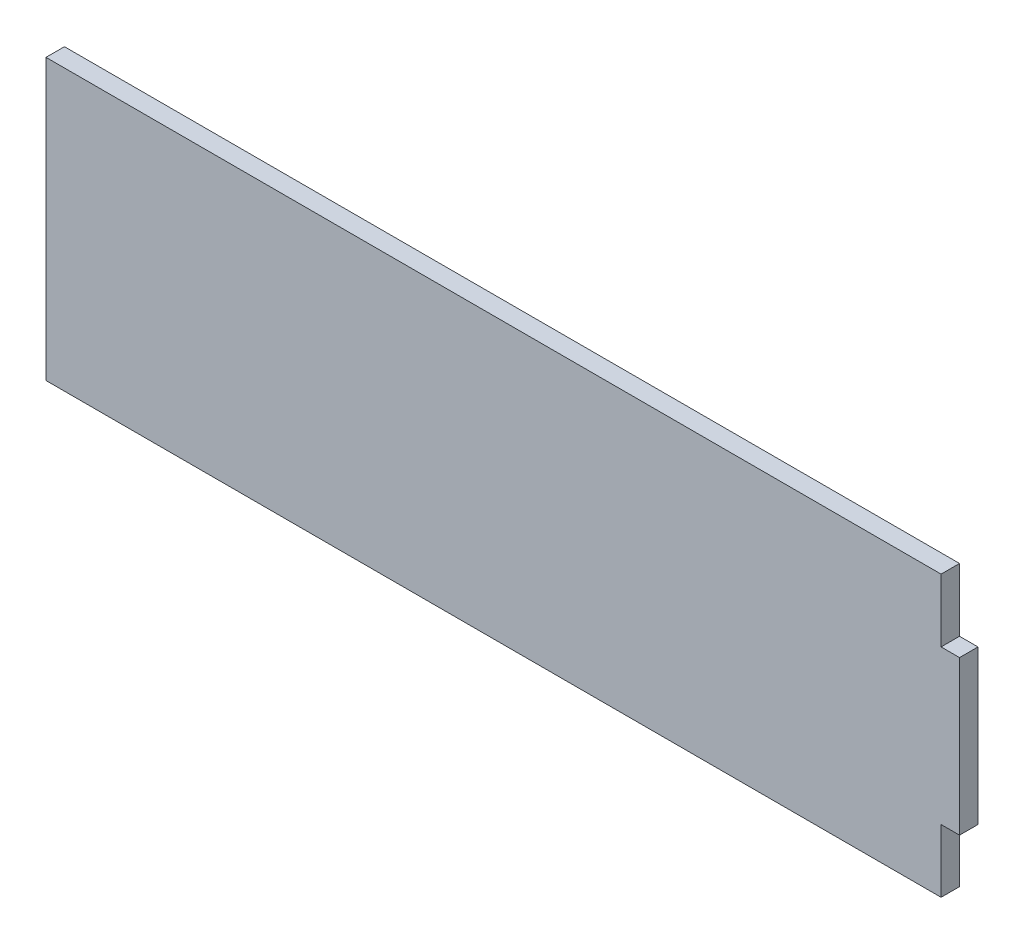
from build123d import *

# Parameters (mm, degrees)
BOSS_EXTRUDE1_DEPTH = 6


with BuildPart() as part:
    # Sketch1 → Boss-Extrude1 (new body)
    with BuildSketch(Plane.XY):
        Polygon((0, 0), (0, -91), (291, -91), (291, -70.5), (297, -70.5), (297, -20.5), (291, -20.5), (291, 0), align=None)
    extrude(amount=BOSS_EXTRUDE1_DEPTH)


solid = part.part
